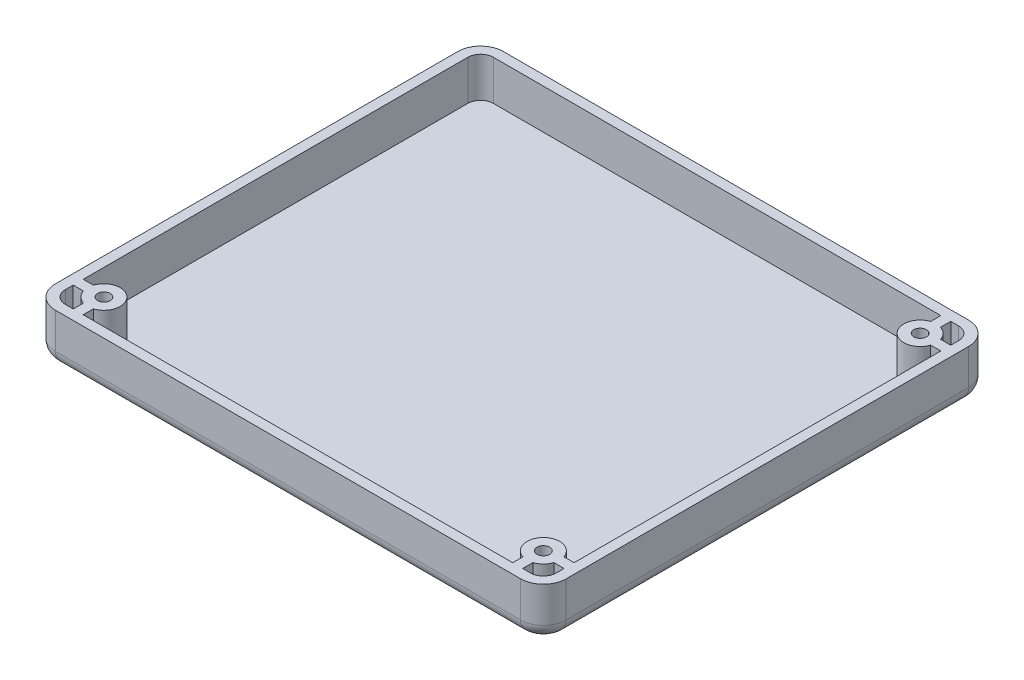
from build123d import *

# Parameters (mm, degrees)
SKETCH1_W               = 89.5
SKETCH1_H               = 78.5
BOSS_EXTRUDE1_DEPTH     = 21.75
FILLET2_R               = 4
SHELL1_T                = -1.75
CUT_EXTRUDE1_DEPTH      = 64.37339745
CUT_EXTRUDE1_DEPTH_BACK = 64.37339745
SKETCH3_W               = 22
SKETCH3_H               = 12
SKETCH3_4_R             = 3.75
CUT_EXTRUDE2_DEPTH      = 64.37339745
BOSS_EXTRUDE2_REACH     = 65.373
SKETCH3_5_R             = 1.1
BOSS_EXTRUDE3_REACH     = 65.373
SKETCH7_R               = 1.1
BOSS_EXTRUDE4_DEPTH     = 1
CUT_EXTRUDE3_DEPTH      = 64.72352395
CUT_EXTRUDE3_DEPTH_BACK = 64.72352395
SKETCH10_OUTSIDE_W      = 115.74
SKETCH10_OUTSIDE_H      = 48.99
SKETCH10_OUTSIDE_W_2    = 100
SKETCH10_OUTSIDE_H_2    = 7
SKETCH11_R              = 1.1
BOSS_EXTRUDE5_DEPTH     = 1.75
FILLET3_R               = 2.5


with BuildPart() as part:
    # Sketch1 → Boss-Extrude1 (new body)
    with BuildSketch(Plane(origin=(0, 0, 0), x_dir=(1, 0, 0), z_dir=(0, 1, 0))):
        Rectangle(SKETCH1_W, SKETCH1_H)
    extrude(amount=BOSS_EXTRUDE1_DEPTH)

    # Fillet2
    fillet2_edges = [part.edges().sort_by_distance(p)[0] for p in [
        (44.75, 10.875, -39.25),
        (44.75, 21.75, 0),
        (0, 21.75, 39.25),
        (44.75, 10.875, 39.25),
        (-44.75, 10.875, 39.25),
        (-44.75, 21.75, 0),
        (0, 21.75, -39.25),
        (-44.75, 10.875, -39.25),
    ]]
    fillet(fillet2_edges, radius=FILLET2_R)

    # Sketch4 → Cut-Loft1 section 0
    with BuildSketch(Plane(origin=(0, 21.75, 0), x_dir=(1, 0, 0), z_dir=(0, 1, 0))):
        with BuildLine():
            Line((5.5, -23), (34.5, -23))
            Line((34.5, -23), (34.5, -4))
            Line((34.5, -4), (5.5, -4))
            Line((5.5, -4), (5.5, -23))
        make_face()
    # Sketch5 → Cut-Loft1 section 1
    with BuildSketch(Plane(origin=(0, 17.75, 0), x_dir=(1, 0, 0), z_dir=(0, 1, 0))):
        with BuildLine():
            Line((31, -19.5), (31, -7.5))
            Line((31, -7.5), (9, -7.5))
            Line((9, -7.5), (9, -19.5))
            Line((9, -19.5), (31, -19.5))
        make_face()
    loft(mode=Mode.SUBTRACT)

    # Shell1
    shell1_openings = [part.faces().sort_by_distance(p)[0] for p in [
        (0, 0, 0),
    ]]
    offset(amount=SHELL1_T, openings=shell1_openings, kind=Kind.INTERSECTION)

    # Sketch3 → Cut-Extrude1 (cut, two sides: drawn at the far end of the back side and taken through both)
    with BuildSketch(Plane(origin=(0, 0, 0), x_dir=(1, 0, 0), z_dir=(0, 1, 0)).offset(-CUT_EXTRUDE1_DEPTH_BACK)):
        with Locations((20, -13.5)):
            Rectangle(SKETCH3_W, SKETCH3_H)
    extrude(amount=CUT_EXTRUDE1_DEPTH + CUT_EXTRUDE1_DEPTH_BACK, mode=Mode.SUBTRACT)

    # Sketch3<4> → Cut-Extrude2 (cut, through all)
    with BuildSketch(Plane(origin=(0, 0, 0), x_dir=(1, 0, 0), z_dir=(0, 1, 0))):
        with Locations((-18.5, -3.5)):
            Circle(SKETCH3_4_R)
        with Locations((-29.5, -14.5)):
            Circle(SKETCH3_4_R)
        with Locations((-18.5, -14.5)):
            Circle(SKETCH3_4_R)
        with Locations((-7.5, -14.5)):
            Circle(SKETCH3_4_R)
        with Locations((-18.5, -25.5)):
            Circle(SKETCH3_4_R)
    extrude(amount=CUT_EXTRUDE2_DEPTH, mode=Mode.SUBTRACT)

    # Sketch3<5> → Boss-Extrude2 (add, up to next)
    with BuildSketch(Plane(origin=(0, 0, 0), x_dir=(1, 0, 0), z_dir=(0, 1, 0)), mode=Mode.PRIVATE) as boss_extrude2_sk1:
        with BuildLine():
            Line((44.75, 32.125), (41.212355987, 32.125))
            ThreePointArc((41.212355987, 32.125), (36.484745674, 30.984745674), (37.625, 35.712355987))
            Line((37.625, 35.712355987), (37.625, 39.25))
            Line((37.625, 39.25), (39.375, 39.25))
            Line((39.375, 39.25), (39.375, 35.712355987))
            ThreePointArc((39.375, 35.712355987), (40.515254326, 35.015254326), (41.212355987, 33.875))
            Line((41.212355987, 33.875), (44.75, 33.875))
            Line((44.75, 33.875), (44.75, 32.125))
        make_face()
        with Locations((38.5, 33)):
            Circle(SKETCH3_5_R, mode=Mode.SUBTRACT)
    boss_extrude2_tool1 = extrude(boss_extrude2_sk1.sketch, amount=BOSS_EXTRUDE2_REACH, mode=Mode.PRIVATE) - part.part
    boss_extrude2 = boss_extrude2_tool1.solids().sort_by_distance((39.30816, 0, -33.80816))[0]
    add(boss_extrude2)

    # Mirror1: Boss-Extrude2 across plane
    add(boss_extrude2.mirror(Plane.XY))

    # Sketch7 → Boss-Extrude3 (add, up to next)
    with BuildSketch(Plane(origin=(0, 0, 0), x_dir=(1, 0, 0), z_dir=(0, 1, 0)), mode=Mode.PRIVATE) as boss_extrude3_sk1:
        with BuildLine():
            Line((-37.625, -35.712355987), (-37.625, -39.25))
            Line((-37.625, -39.25), (-39.375, -39.25))
            Line((-39.375, -39.25), (-39.375, -35.712355987))
            ThreePointArc((-39.375, -35.712355987), (-40.515254326, -35.015254326), (-41.212355987, -33.875))
            Line((-41.212355987, -33.875), (-44.75, -33.875))
            Line((-44.75, -33.875), (-44.75, -32.125))
            Line((-44.75, -32.125), (-41.212355987, -32.125))
            ThreePointArc((-41.212355987, -32.125), (-36.484745674, -30.984745674), (-37.625, -35.712355987))
        make_face()
        with Locations((-38.5, -33)):
            Circle(SKETCH7_R, mode=Mode.SUBTRACT)
    boss_extrude3_tool1 = extrude(boss_extrude3_sk1.sketch, amount=BOSS_EXTRUDE3_REACH, mode=Mode.PRIVATE) - part.part
    add(boss_extrude3_tool1.solids().sort_by_distance((-39.30816, 0, 33.80816))[0])

    # Sketch8 → Boss-Extrude4 (add)
    # profile 1 of 9: a face of its own
    with BuildSketch(Plane(origin=(0, 21.75, 0), x_dir=(1, 0, 0), z_dir=(0, 1, 0))):
        with BuildLine():
            Line((-32.428807867, 23.991700279), (-30.570364358, 23.991700279))
            add(Edge.make_bspline(
                [(-30.570364358, 23.991700279), (-30.479391142, 23.991221987), (-30.303062409, 23.990294938), (-30.046650928, 23.975917274), (-29.806488093, 23.956313001), (-29.582504256, 23.92520682), (-29.374802916, 23.887673484), (-29.182758131, 23.842220684), (-29.006980591, 23.787719686), (-28.797123787, 23.701052306), (-28.557853988, 23.572265684), (-28.298778363, 23.381960089), (-28.07724254, 23.1491896), (-27.886235491, 22.886618945), (-27.73437673, 22.597778023), (-27.62451457, 22.289551231), (-27.554960638, 21.965914204), (-27.547807542, 21.743728127), (-27.544192483, 21.631438861)],
                knots=[0, 0, 0, 0, 1.001505555, 1.941167018, 2.826882275, 3.653841531, 4.429895133, 5.150066043, 5.825578002, 6.45369114, 7.647487171, 8.808567382, 9.977351308, 11.170798116, 12.373658725, 13.556498008, 14.765093433, 16, 16, 16, 16], degree=3))
            add(Edge.make_bspline(
                [(-27.544192483, 21.631438861), (-27.547167599, 21.526248692), (-27.553013982, 21.319540089), (-27.608919634, 21.017205406), (-27.696442596, 20.729411018), (-27.818104738, 20.45720724), (-27.976225171, 20.206744336), (-28.163618167, 19.976001847), (-28.389705751, 19.774749328), (-28.559096282, 19.662237572), (-28.645138997, 19.605086698)],
                knots=[0, 0, 0, 0, 1.044552857, 2.05264487, 3.044412934, 4.028983338, 5.005914585, 5.980388656, 6.974128949, 8, 8, 8, 8], degree=3))
            add(Edge.make_bspline(
                [(-28.645138997, 19.605086698), (-28.536933833, 19.563544093), (-28.329910551, 19.484062801), (-28.045015046, 19.343540574), (-27.799556217, 19.190699402), (-27.591646842, 19.023789152), (-27.413835081, 18.843878746), (-27.258569575, 18.648330185), (-27.126086693, 18.434592565), (-27.012567951, 18.204894373), (-26.923988836, 17.961581055), (-26.857651554, 17.706934872), (-26.819640139, 17.441868939), (-26.814230915, 17.261478014), (-26.811500175, 17.170411217)],
                knots=[0, 0, 0, 0, 1.27268992, 2.434971085, 3.483601985, 4.442670788, 5.356604649, 6.2567628, 7.179492994, 8.113709626, 9.066344395, 10.018646069, 10.999752585, 12, 12, 12, 12], degree=3))
            add(Edge.make_bspline(
                [(-26.811500175, 17.170411217), (-26.814158592, 17.077428515), (-26.819389101, 16.894482444), (-26.857978881, 16.625727399), (-26.923317951, 16.368892723), (-27.013318714, 16.12231719), (-27.13078187, 15.886477824), (-27.273732973, 15.661107441), (-27.444180299, 15.448470442), (-27.634851393, 15.24620401), (-27.85055766, 15.06433696), (-28.083282679, 14.902369216), (-28.335957307, 14.769166004), (-28.604431662, 14.657271688), (-28.891717408, 14.571799241), (-29.196524504, 14.512002451), (-29.518590068, 14.4717116), (-29.739596605, 14.468399064), (-29.852936473, 14.466700279)],
                knots=[0, 0, 0, 0, 0.978564426, 1.925352924, 2.850884081, 3.763762016, 4.682927383, 5.618979971, 6.567305752, 7.547517671, 8.540179244, 9.531824382, 10.526200242, 11.540722885, 12.589160233, 13.674978461, 14.80764778, 16, 16, 16, 16], degree=3))
            Line((-29.852936473, 14.466700279), (-32.428807867, 14.466700279))
            Line((-32.428807867, 14.466700279), (-32.428807867, 23.991700279))
        make_face()
        with BuildLine():
            Line((-31.574000175, 23.014777203), (-31.574000175, 19.961892587))
            Line((-31.574000175, 19.961892587), (-30.999676257, 19.961892587))
            add(Edge.make_bspline(
                [(-30.999676257, 19.961892587), (-30.915723464, 19.962980949), (-30.753509559, 19.965083886), (-30.518596126, 19.971107815), (-30.300541612, 19.987975347), (-30.099722409, 20.004838032), (-29.916454758, 20.032255302), (-29.751144678, 20.064891008), (-29.601197782, 20.099406629), (-29.428279447, 20.158106447), (-29.232138066, 20.244859263), (-29.023042261, 20.379493331), (-28.838707741, 20.539851749), (-28.68304968, 20.724884295), (-28.555655606, 20.928627272), (-28.467171853, 21.147829854), (-28.407171744, 21.377028928), (-28.401751934, 21.534377173), (-28.399000175, 21.614266385)],
                knots=[0, 0, 0, 0, 1.156816544, 2.235205308, 3.236616184, 4.169592532, 5.011045266, 5.787822928, 6.49130361, 7.128639758, 8.301311294, 9.436451833, 10.541879658, 11.654887649, 12.756523258, 13.837046038, 14.901820046, 16, 16, 16, 16], degree=3))
            add(Edge.make_bspline(
                [(-28.399000175, 21.614266385), (-28.400432137, 21.667132235), (-28.403241086, 21.770834372), (-28.426246145, 21.922007971), (-28.465346473, 22.064185612), (-28.515568514, 22.199315727), (-28.585750588, 22.323172976), (-28.668382585, 22.440039816), (-28.76822007, 22.545936367), (-28.881859614, 22.644913359), (-29.012511652, 22.732664538), (-29.160098239, 22.809519758), (-29.326616132, 22.871407157), (-29.509258973, 22.925607544), (-29.710838147, 22.963675686), (-29.929027467, 22.995389548), (-30.165614095, 23.011535082), (-30.329294696, 23.013672391), (-30.413904021, 23.014777203)],
                knots=[0, 0, 0, 0, 0.91205012, 1.789085906, 2.630437955, 3.453916878, 4.269457761, 5.079663411, 5.91843418, 6.774407191, 7.675494373, 8.627863946, 9.638891023, 10.736472738, 11.911756761, 13.175263542, 14.539845004, 16, 16, 16, 16], degree=3))
            Line((-30.413904021, 23.014777203), (-31.574000175, 23.014777203))
        make_face(mode=Mode.SUBTRACT)
        with BuildLine():
            Line((-31.574000175, 18.98496951), (-31.574000175, 15.443623356))
            Line((-31.574000175, 15.443623356), (-30.356662435, 15.443623356))
            add(Edge.make_bspline(
                [(-30.356662435, 15.443623356), (-30.269525215, 15.444667698), (-30.101579711, 15.446680527), (-29.859097078, 15.453251565), (-29.634353059, 15.468198401), (-29.428373204, 15.491727463), (-29.23893333, 15.517250243), (-29.068306009, 15.551570943), (-28.915108104, 15.590892757), (-28.737468738, 15.651673612), (-28.537434191, 15.746097579), (-28.321867503, 15.888467009), (-28.130207581, 16.05807544), (-27.96745184, 16.254374571), (-27.834066492, 16.467819825), (-27.737032718, 16.694093955), (-27.677186172, 16.929458141), (-27.669941269, 17.089931837), (-27.666307867, 17.170411217)],
                knots=[0, 0, 0, 0, 1.160039823, 2.235823828, 3.228722157, 4.157150951, 4.99529583, 5.772374946, 6.472645482, 7.099169577, 8.269452708, 9.405989375, 10.527446681, 11.663510218, 12.788923519, 13.866172445, 14.929861265, 16, 16, 16, 16], degree=3))
            add(Edge.make_bspline(
                [(-27.666307867, 17.170411217), (-27.667059265, 17.220739522), (-27.668549942, 17.320584333), (-27.691030615, 17.467312383), (-27.723725504, 17.609441367), (-27.765993192, 17.747357218), (-27.827550456, 17.878566478), (-27.899413982, 18.005664158), (-27.983673225, 18.12881827), (-28.114966276, 18.284517331), (-28.30593432, 18.463905773), (-28.577279187, 18.639539976), (-28.885813798, 18.781184365), (-29.109590047, 18.841326511), (-29.225187074, 18.87239439)],
                knots=[0, 0, 0, 0, 0.723448775, 1.435228256, 2.130040452, 2.821711965, 3.505591119, 4.210454504, 4.921174351, 5.648778258, 7.137944449, 8.670945889, 10.280296675, 12, 12, 12, 12], degree=3))
            add(Edge.make_bspline(
                [(-29.225187074, 18.87239439), (-29.271530542, 18.881797154), (-29.37201274, 18.902184286), (-29.535863369, 18.923704536), (-29.722923127, 18.942877164), (-29.933623957, 18.957058957), (-30.168232439, 18.971718051), (-30.427249625, 18.977418957), (-30.709617745, 18.984220514), (-30.905539845, 18.984713458), (-31.007308468, 18.98496951)],
                knots=[0, 0, 0, 0, 0.634451884, 1.375622551, 2.216452059, 3.157844607, 4.20941857, 5.370758133, 6.634282058, 8, 8, 8, 8], degree=3))
            Line((-31.007308468, 18.98496951), (-31.574000175, 18.98496951))
        make_face(mode=Mode.SUBTRACT)
    # profile 2 of 9: a face of its own
    with BuildSketch(Plane(origin=(0, 21.75, 0), x_dir=(1, 0, 0), z_dir=(0, 1, 0))):
        with BuildLine():
            Line((-18.019192483, 21.427277203), (-18.019192483, 14.466700279))
            Line((-18.019192483, 14.466700279), (-18.874000175, 14.466700279))
            Line((-18.874000175, 14.466700279), (-18.874000175, 15.67068165))
            add(Edge.make_bspline(
                [(-18.874000175, 15.67068165), (-18.970389884, 15.561716755), (-19.158495612, 15.349070392), (-19.472660369, 15.071261051), (-19.805676625, 14.841631476), (-20.155928077, 14.656166348), (-20.52309844, 14.516850824), (-20.906373791, 14.417828491), (-21.305910478, 14.354163839), (-21.578740101, 14.347806522), (-21.716998973, 14.344584895)],
                knots=[0, 0, 0, 0, 1.074387032, 2.096679803, 3.090159297, 4.057316773, 5.018401886, 5.985159533, 6.978961417, 8, 8, 8, 8], degree=3))
            add(Edge.make_bspline(
                [(-21.716998973, 14.344584895), (-21.839920333, 14.347922379), (-22.082326698, 14.354504047), (-22.438912972, 14.405564316), (-22.782064022, 14.48756265), (-23.112104109, 14.601592928), (-23.426897591, 14.752852164), (-23.729139711, 14.933939418), (-24.01726468, 15.149587677), (-24.286880797, 15.396116525), (-24.535162169, 15.663891455), (-24.753043204, 15.949493265), (-24.934706943, 16.251686963), (-25.086617305, 16.566646475), (-25.203628786, 16.896796363), (-25.28519989, 17.240994941), (-25.336200677, 17.59883524), (-25.342779624, 17.842510656), (-25.34611556, 17.96606927)],
                knots=[0, 0, 0, 0, 1.033919861, 2.038935746, 3.024066025, 3.998881131, 4.97069526, 5.957263378, 6.95902576, 7.993208707, 9.027059324, 10.027763471, 11.009749337, 11.988697705, 12.965288445, 13.950418724, 14.960734635, 16, 16, 16, 16], degree=3))
            add(Edge.make_bspline(
                [(-25.34611556, 17.96606927), (-25.342705687, 18.087074063), (-25.335964554, 18.326294012), (-25.285745434, 18.678116754), (-25.201296761, 19.016984307), (-25.082784404, 19.341805702), (-24.930814512, 19.652973981), (-24.745953076, 19.950709221), (-24.528186743, 20.235831653), (-24.277128407, 20.50163692), (-24.005163068, 20.747165877), (-23.714218593, 20.960550494), (-23.411532378, 21.144837061), (-23.092409471, 21.290851164), (-22.761573278, 21.408985942), (-22.416078544, 21.490718519), (-22.057362747, 21.538880515), (-21.813820766, 21.545854894), (-21.690286233, 21.549392587)],
                knots=[0, 0, 0, 0, 1.020392517, 2.01726096, 2.990465484, 3.961182959, 4.928053699, 5.906110375, 6.912531644, 7.948652711, 8.985773172, 9.998621852, 10.987621588, 11.969261332, 12.953316658, 13.946091881, 14.958173133, 16, 16, 16, 16], degree=3))
            add(Edge.make_bspline(
                [(-21.690286233, 21.549392587), (-21.548228045, 21.545479849), (-21.269658643, 21.537807154), (-20.862184561, 21.473955018), (-20.476709231, 21.366081761), (-20.110257031, 21.219349141), (-19.764143878, 21.024362243), (-19.44164647, 20.778399634), (-19.139389691, 20.483012547), (-18.964183326, 20.256125837), (-18.874000175, 20.139341505)],
                knots=[0, 0, 0, 0, 1.038897134, 2.037228247, 3.008116434, 3.962042015, 4.918381754, 5.904844433, 6.921570401, 8, 8, 8, 8], degree=3))
            Line((-18.874000175, 20.139341505), (-18.874000175, 21.427277203))
            Line((-18.874000175, 21.427277203), (-18.019192483, 21.427277203))
        make_face()
        with BuildLine():
            add(Edge.make_bspline(
                [(-21.678837915, 20.694584895), (-21.803790506, 20.690139066), (-22.050427046, 20.681363708), (-22.412496795, 20.612855839), (-22.758971157, 20.498869908), (-23.088117259, 20.342981305), (-23.394735763, 20.146960243), (-23.668766396, 19.909865622), (-23.912450462, 19.638166319), (-24.117396524, 19.333088433), (-24.284466376, 19.006032342), (-24.40194237, 18.664154407), (-24.479419393, 18.313620861), (-24.487334724, 18.075869552), (-24.491307867, 17.956529005)],
                knots=[0, 0, 0, 0, 1.031046209, 2.035121221, 3.029706178, 4.034933723, 5.034054252, 6.02443088, 7.017295772, 8.038157696, 9.050218397, 10.03989886, 11.016116709, 12, 12, 12, 12], degree=3))
            add(Edge.make_bspline(
                [(-24.491307867, 17.956529005), (-24.486232693, 17.837901642), (-24.476102238, 17.601111895), (-24.403302134, 17.250100468), (-24.281164765, 16.908141968), (-24.114498865, 16.578138836), (-23.905801694, 16.271749249), (-23.663897575, 15.994870772), (-23.386447167, 15.756774107), (-23.079123022, 15.557463282), (-22.750897046, 15.396456707), (-22.405727561, 15.284427359), (-22.050103145, 15.212097828), (-21.808297865, 15.203649216), (-21.686470127, 15.199392587)],
                knots=[0, 0, 0, 0, 0.979072187, 1.954306742, 2.945804271, 3.96968567, 4.997920485, 5.998718438, 6.996577872, 8.005894225, 9.015743152, 10.005417472, 10.995077863, 12, 12, 12, 12], degree=3))
            add(Edge.make_bspline(
                [(-21.686470127, 15.199392587), (-21.562790716, 15.20391006), (-21.316804634, 15.212894867), (-20.953660722, 15.281696024), (-20.60124943, 15.395366826), (-20.26437133, 15.552935163), (-19.950546716, 15.748217682), (-19.668884635, 15.97683698), (-19.430716178, 16.242729216), (-19.22880629, 16.534946564), (-19.070486049, 16.855291354), (-18.955162631, 17.196379402), (-18.886980216, 17.558222581), (-18.87838668, 17.805502267), (-18.874000175, 17.931724318)],
                knots=[0, 0, 0, 0, 1.01762866, 2.023962475, 3.030623092, 4.058876274, 5.077231937, 6.066672613, 7.034107872, 8.005628644, 8.981990164, 9.965428785, 10.961468474, 12, 12, 12, 12], degree=3))
            add(Edge.make_bspline(
                [(-18.874000175, 17.931724318), (-18.876611811, 18.0278937), (-18.881752338, 18.217185476), (-18.921024102, 18.49511822), (-18.983494295, 18.761093575), (-19.071522086, 19.015391178), (-19.187159081, 19.256605042), (-19.326626216, 19.486467132), (-19.492376047, 19.703781943), (-19.681740384, 19.905557015), (-19.889018542, 20.089597601), (-20.108350828, 20.253874571), (-20.342335846, 20.388826874), (-20.58703864, 20.500517763), (-20.842883771, 20.589397306), (-21.111953101, 20.648690959), (-21.39138663, 20.689404404), (-21.582011966, 20.692839883), (-21.678837915, 20.694584895)],
                knots=[0, 0, 0, 0, 1.050140795, 2.067009409, 3.05949893, 4.030605086, 5.00011959, 5.97591094, 6.962425594, 7.979863591, 8.993523472, 9.986985069, 10.967611495, 11.937549037, 12.921786183, 13.919465291, 14.943216303, 16, 16, 16, 16], degree=3))
        make_face(mode=Mode.SUBTRACT)
    # profile 3 of 9: a face of its own
    with BuildSketch(Plane(origin=(0, 21.75, 0), x_dir=(1, 0, 0), z_dir=(0, 1, 0))):
        with BuildLine():
            Line((-16.065346329, 14.466700279), (-16.065346329, 24.235931049))
            Line((-16.065346329, 24.235931049), (-15.210538636, 24.235931049))
            Line((-15.210538636, 24.235931049), (-15.210538636, 20.164146193))
            add(Edge.make_bspline(
                [(-15.210538636, 20.164146193), (-15.114217975, 20.275065993), (-14.926292393, 20.491475096), (-14.611215051, 20.774089058), (-14.280818465, 21.013717585), (-13.932589212, 21.211255522), (-13.566032015, 21.361678695), (-13.183039634, 21.471685342), (-12.782633016, 21.538052557), (-12.50962155, 21.545580227), (-12.371355944, 21.549392587)],
                knots=[0, 0, 0, 0, 1.077089805, 2.101446609, 3.097517232, 4.067117542, 5.031729543, 5.997785507, 6.985986182, 8, 8, 8, 8], degree=3))
            add(Edge.make_bspline(
                [(-12.371355944, 21.549392587), (-12.248439526, 21.546017395), (-12.00541282, 21.539344064), (-11.648137834, 21.488631616), (-11.304385278, 21.406396026), (-10.974342265, 21.292389453), (-10.659548818, 21.14112435), (-10.357309528, 20.960036934), (-10.069172877, 20.744395481), (-9.799602081, 20.49783865), (-9.551152291, 20.230168126), (-9.333676103, 19.943927411), (-9.149980501, 19.643277344), (-8.998039626, 19.329224317), (-8.880552689, 19.000485676), (-8.799611233, 18.657383749), (-8.74819402, 18.30025607), (-8.74171635, 18.057197655), (-8.738423252, 17.933632371)],
                knots=[0, 0, 0, 0, 1.034377878, 2.045141349, 3.03070803, 4.00595497, 4.978199603, 5.965204761, 6.967410914, 8.002051993, 9.036360596, 10.037508045, 11.022711142, 11.997267194, 12.969246472, 13.954813154, 14.960274251, 16, 16, 16, 16], degree=3))
            add(Edge.make_bspline(
                [(-8.738423252, 17.933632371), (-8.741788136, 17.811984466), (-8.748423159, 17.572113954), (-8.799099719, 17.219126826), (-8.882773482, 16.879387223), (-9.002410702, 16.553773037), (-9.152810285, 16.240754559), (-9.340891686, 15.943900031), (-9.55809162, 15.658043961), (-9.809364245, 15.392368221), (-10.081271843, 15.146804468), (-10.372231318, 14.933428507), (-10.674913834, 14.749141201), (-10.994037018, 14.603121733), (-11.324875759, 14.485009226), (-11.67097449, 14.403046082), (-12.030375132, 14.355222268), (-12.274538679, 14.348158617), (-12.398068685, 14.344584895)],
                knots=[0, 0, 0, 0, 1.024244038, 2.01964794, 2.996620209, 3.965911562, 4.936179293, 5.91563013, 6.920572822, 7.955171681, 8.990768464, 10.002129126, 10.989675881, 11.969873457, 12.952483066, 13.943799762, 14.959703725, 16, 16, 16, 16], degree=3))
            add(Edge.make_bspline(
                [(-12.398068685, 14.344584895), (-12.539488026, 14.348505407), (-12.816786696, 14.356192849), (-13.222422878, 14.419925928), (-13.606366237, 14.528406453), (-13.972990423, 14.674170945), (-14.31705444, 14.871552496), (-14.640742739, 15.116363367), (-14.942014061, 15.412637502), (-15.119496965, 15.638683414), (-15.210538636, 15.754635977)],
                knots=[0, 0, 0, 0, 1.035807596, 2.031038093, 2.998900396, 3.954262848, 4.914341711, 5.895762244, 6.92060972, 8, 8, 8, 8], degree=3))
            Line((-15.210538636, 15.754635977), (-15.210538636, 14.466700279))
            Line((-15.210538636, 14.466700279), (-16.065346329, 14.466700279))
        make_face()
        with BuildLine():
            add(Edge.make_bspline(
                [(-12.405700896, 15.199392587), (-12.280748265, 15.203838392), (-12.034111647, 15.212613702), (-11.672042474, 15.281121919), (-11.325565947, 15.395106543), (-10.996427988, 15.551000064), (-10.689779288, 15.747002887), (-10.415860334, 15.984164966), (-10.172347696, 16.25495123), (-9.96918822, 16.56038721), (-9.799571798, 16.88546449), (-9.683058524, 17.227423696), (-9.604899855, 17.577113087), (-9.597137528, 17.814274822), (-9.593230944, 17.933632371)],
                knots=[0, 0, 0, 0, 1.031910345, 2.036826888, 3.032245421, 4.038315463, 5.03827337, 6.029480047, 7.023177075, 8.037597977, 9.052889626, 10.043399556, 11.015292101, 12, 12, 12, 12], degree=3))
            add(Edge.make_bspline(
                [(-9.593230944, 17.933632371), (-9.598368304, 18.052873238), (-9.608622515, 18.290878933), (-9.680399602, 18.643711242), (-9.805742587, 18.985488992), (-9.972070922, 19.315266232), (-10.178540225, 19.622808889), (-10.420763597, 19.899007021), (-10.698027655, 20.137295264), (-11.005068532, 20.335932529), (-11.332130337, 20.498019598), (-11.676365561, 20.609176417), (-12.030581595, 20.681942484), (-12.271143615, 20.690349326), (-12.392344526, 20.694584895)],
                knots=[0, 0, 0, 0, 0.984795267, 1.965658976, 2.959410029, 3.983795688, 5.009594896, 6.01088574, 7.009236619, 8.019050059, 9.024672985, 10.014834719, 10.999826153, 12, 12, 12, 12], degree=3))
            add(Edge.make_bspline(
                [(-12.392344526, 20.694584895), (-12.5160811, 20.69035172), (-12.761673091, 20.681949726), (-13.124080896, 20.609048576), (-13.478038833, 20.497340433), (-13.816278473, 20.336962976), (-14.13156701, 20.140716787), (-14.413541333, 19.910102387), (-14.656650786, 19.64672278), (-14.856794905, 19.351431991), (-15.015739394, 19.032521287), (-15.129450879, 18.692309505), (-15.197485632, 18.332587505), (-15.206134693, 18.085935709), (-15.210538636, 17.960345111)],
                knots=[0, 0, 0, 0, 1.016820015, 2.018181405, 3.029022337, 4.06341356, 5.088169224, 6.076823655, 7.05054209, 8.02560866, 9.001194327, 9.972267242, 10.967515442, 12, 12, 12, 12], degree=3))
            add(Edge.make_bspline(
                [(-15.210538636, 17.960345111), (-15.207926962, 17.864175763), (-15.20278636, 17.674884051), (-15.163515142, 17.396950836), (-15.101042949, 17.130977206), (-15.01302244, 16.876673325), (-14.897358366, 16.6354828), (-14.757993285, 16.405532754), (-14.592117733, 16.188898118), (-14.404593372, 15.986109996), (-14.197867179, 15.801571518), (-13.976007835, 15.641610777), (-13.743549037, 15.503867874), (-13.49783133, 15.394072267), (-13.241714176, 15.304465093), (-12.972569404, 15.245318256), (-12.693156457, 15.204564758), (-12.502528285, 15.201134797), (-12.405700896, 15.199392587)],
                knots=[0, 0, 0, 0, 1.050331198, 2.067384183, 3.060053655, 4.031335885, 5.001026174, 5.976994447, 6.963687968, 7.976578778, 8.990422448, 9.985569286, 10.960374351, 11.936812464, 12.921228065, 13.919088064, 14.943024695, 16, 16, 16, 16], degree=3))
        make_face(mode=Mode.SUBTRACT)
    # profile 4 of 9: a face of its own
    with BuildSketch(Plane(origin=(0, 21.75, 0), x_dir=(1, 0, 0), z_dir=(0, 1, 0))):
        Polygon((-7.761500175, 21.427277203), (-6.839910632, 21.427277203), (-4.483465319, 16.096177443), (-2.090767002, 21.427277203), (-1.167269406, 21.427277203), (-5.441307867, 11.902277203), (-6.364805463, 11.902277203), (-4.94712217, 15.060104727), align=None)
    # profile 5 of 9: a face of its own
    with BuildSketch(Plane(origin=(0, 21.75, 0), x_dir=(1, 0, 0), z_dir=(0, 1, 0))):
        with BuildLine():
            Line((0.175999825, 23.991700279), (2.082144657, 23.991700279))
            add(Edge.make_bspline(
                [(2.082144657, 23.991700279), (2.209347299, 23.991276863), (2.453590464, 23.990463857), (2.803493435, 23.985930603), (3.121430035, 23.972937535), (3.407234026, 23.961756318), (3.660900166, 23.941367535), (3.883206293, 23.921880345), (4.073128527, 23.896370597), (4.188097594, 23.87267941), (4.240152469, 23.861952683)],
                knots=[0, 0, 0, 0, 1.410062039, 2.707475311, 3.878576406, 4.937260626, 5.877586885, 6.699081471, 7.410979367, 8, 8, 8, 8], degree=3))
            add(Edge.make_bspline(
                [(4.240152469, 23.861952683), (4.309839068, 23.844734843), (4.447725661, 23.810666466), (4.646254055, 23.738658553), (4.835432322, 23.655329432), (5.01447463, 23.557456736), (5.182484176, 23.444313942), (5.341193293, 23.317854266), (5.491322161, 23.178769656), (5.626799312, 23.023553409), (5.754540588, 22.860712622), (5.862278207, 22.684625969), (5.955150984, 22.500489955), (6.029093606, 22.306431911), (6.088632948, 22.104333803), (6.130614356, 21.892365007), (6.155790803, 21.67149121), (6.158353995, 21.520838616), (6.159653671, 21.444449679)],
                knots=[0, 0, 0, 0, 1.027469482, 2.033020251, 3.019912614, 3.986113645, 4.951240523, 5.91722682, 6.890402269, 7.87763091, 8.8651537, 9.85103654, 10.82876324, 11.815024772, 12.821070561, 13.842952187, 14.906261191, 16, 16, 16, 16], degree=3))
            add(Edge.make_bspline(
                [(6.159653671, 21.444449679), (6.155655898, 21.317535572), (6.147855206, 21.06989328), (6.075124746, 20.710499024), (5.955990074, 20.375248103), (5.791824552, 20.064562639), (5.582765836, 19.784498668), (5.331510511, 19.538507501), (5.037918412, 19.332658881), (4.764607202, 19.18991232), (4.523177844, 19.098491619), (4.3244229, 19.034166956), (4.107614911, 18.984468322), (3.874831165, 18.939945392), (3.625102931, 18.906331138), (3.359028752, 18.881711477), (3.076418868, 18.866324388), (2.882274687, 18.864032932), (2.782400065, 18.862854126)],
                knots=[0, 0, 0, 0, 1.260483769, 2.459530307, 3.627416485, 4.787058657, 5.939039949, 7.08810263, 8.267026773, 9.491475466, 10.141966685, 10.831826277, 11.566392101, 12.351337768, 13.187381173, 14.07005841, 15.007169909, 16, 16, 16, 16], degree=3))
            Line((2.782400065, 18.862854126), (6.281769056, 14.466700279))
            Line((6.281769056, 14.466700279), (5.224707758, 14.466700279))
            Line((5.224707758, 14.466700279), (1.725338767, 18.862854126))
            Line((1.725338767, 18.862854126), (1.030807517, 18.862854126))
            Line((1.030807517, 18.862854126), (1.030807517, 14.466700279))
            Line((1.030807517, 14.466700279), (0.175999825, 14.466700279))
            Line((0.175999825, 14.466700279), (0.175999825, 23.991700279))
        make_face()
        with BuildLine():
            Line((1.030807517, 23.014777203), (1.030807517, 19.839777203))
            Line((1.030807517, 19.839777203), (2.774767854, 19.826420832))
            add(Edge.make_bspline(
                [(2.774767854, 19.826420832), (2.856193103, 19.82638481), (3.014018426, 19.826314988), (3.242348092, 19.837183764), (3.454946396, 19.849548081), (3.651000158, 19.868460228), (3.830596959, 19.892833538), (3.993647034, 19.923321659), (4.140416539, 19.958841915), (4.311590419, 20.013819197), (4.502734122, 20.100921289), (4.710464738, 20.227645968), (4.887363957, 20.387037642), (5.036818996, 20.569301119), (5.156914092, 20.76969691), (5.241583326, 20.985822887), (5.295310972, 21.212222878), (5.301647942, 21.367829015), (5.304845979, 21.446357731)],
                knots=[0, 0, 0, 0, 1.146690395, 2.22261258, 3.21895312, 4.145990853, 4.996080663, 5.770904154, 6.481378293, 7.121626537, 8.300444488, 9.431385265, 10.535395872, 11.636531494, 12.74115979, 13.810798291, 14.895190096, 16, 16, 16, 16], degree=3))
            add(Edge.make_bspline(
                [(5.304845979, 21.446357731), (5.301574492, 21.522956621), (5.295091599, 21.674747671), (5.242163165, 21.896968398), (5.152657063, 22.106700598), (5.032037258, 22.303091089), (4.885082415, 22.481360271), (4.712767511, 22.633888594), (4.519804087, 22.759753209), (4.339451754, 22.840183344), (4.178250076, 22.889495231), (4.038287929, 22.924196612), (3.880141694, 22.952076203), (3.703043481, 22.974413854), (3.507749329, 22.993613381), (3.293271771, 23.006545007), (3.061033819, 23.014202737), (2.900069671, 23.014581258), (2.816745017, 23.014777203)],
                knots=[0, 0, 0, 0, 1.101028733, 2.181837193, 3.264309656, 4.369019818, 5.486613113, 6.575447106, 7.666700264, 8.788928104, 9.402425223, 10.0903467, 10.862060571, 11.710948788, 12.657782767, 13.684531032, 14.801375019, 16, 16, 16, 16], degree=3))
            Line((2.816745017, 23.014777203), (1.030807517, 23.014777203))
        make_face(mode=Mode.SUBTRACT)
    # profile 6 of 9: a face of its own
    with BuildSketch(Plane(origin=(0, 21.75, 0), x_dir=(1, 0, 0), z_dir=(0, 1, 0))):
        Polygon((7.136576748, 23.014777203), (7.136576748, 23.991700279), (12.143307517, 23.991700279), (12.143307517, 23.014777203), (10.067345979, 23.014777203), (10.067345979, 14.466700279), (9.212538287, 14.466700279), (9.212538287, 23.014777203), align=None)
    # profile 7 of 9: a face of its own
    with BuildSketch(Plane(origin=(0, 21.75, 0), x_dir=(1, 0, 0), z_dir=(0, 1, 0))):
        with BuildLine():
            add(Edge.make_bspline(
                [(18.065903671, 24.235931049), (18.242274302, 24.23146388), (18.588680773, 24.222689992), (19.097791745, 24.155527574), (19.58382554, 24.03933512), (20.050741417, 23.884586575), (20.492954447, 23.678154283), (20.913793147, 23.428639701), (21.312256211, 23.133428767), (21.68297297, 22.794803514), (22.022217956, 22.426367114), (22.321101261, 22.033180802), (22.571587789, 21.617621918), (22.77728911, 21.180939229), (22.938666041, 20.724120316), (23.050024295, 20.24472978), (23.121157404, 19.745873717), (23.129473484, 19.405622035), (23.133692133, 19.233016385)],
                knots=[0, 0, 0, 0, 1.065120563, 2.091984664, 3.0946048, 4.079830382, 5.057816894, 6.036188127, 7.030412546, 8.04752943, 9.064399622, 10.05169764, 11.02544977, 11.989514704, 12.962713494, 13.945757189, 14.957906945, 16, 16, 16, 16], degree=3))
            add(Edge.make_bspline(
                [(23.133692133, 19.233016385), (23.129474102, 19.061682192), (23.121159875, 18.723962648), (23.049943416, 18.228272275), (22.938253266, 17.751775451), (22.778787713, 17.295267639), (22.574066947, 16.858267269), (22.321912517, 16.441924201), (22.024892508, 16.046101945), (21.686872434, 15.675136763), (21.31838817, 15.334965075), (20.923154373, 15.038550135), (20.510059695, 14.783486624), (20.073788275, 14.579968197), (19.620126032, 14.417303185), (19.14501271, 14.306397813), (18.650674587, 14.234859503), (18.313568499, 14.226644827), (18.142225787, 14.22246951)],
                knots=[0, 0, 0, 0, 1.043624062, 2.057103931, 3.04512605, 4.022047818, 4.998200453, 5.980619268, 6.982898556, 8.009068085, 9.034988726, 10.034168286, 11.015286542, 11.987931943, 12.962482838, 13.94673481, 14.956375938, 16, 16, 16, 16], degree=3))
            add(Edge.make_bspline(
                [(18.142225787, 14.22246951), (17.969621033, 14.226686056), (17.629371117, 14.23499799), (17.129888185, 14.306248813), (16.650160896, 14.417667647), (16.191561126, 14.576896898), (15.753833139, 14.78268379), (15.336120842, 15.033611422), (14.940100877, 15.331355142), (14.569056553, 15.669265606), (14.229560521, 16.037125329), (13.933579648, 16.431281409), (13.68259559, 16.844000902), (13.477499664, 17.276429164), (13.315127099, 17.726475733), (13.204351844, 18.197142661), (13.132680432, 18.685746602), (13.124421314, 19.018421918), (13.120230594, 19.187223116)],
                knots=[0, 0, 0, 0, 1.053102029, 2.075944431, 3.073151272, 4.055350789, 5.033113405, 6.020478099, 7.024410459, 8.052272461, 9.079885166, 10.07527673, 11.055994387, 12.023226415, 12.992069828, 13.970394897, 14.97016774, 16, 16, 16, 16], degree=3))
            add(Edge.make_bspline(
                [(13.120230594, 19.187223116), (13.121685567, 19.300523451), (13.124577156, 19.525694787), (13.159388834, 19.860067464), (13.209903178, 20.189062754), (13.282298382, 20.511745119), (13.376981419, 20.827324656), (13.488701579, 21.137977804), (13.625153587, 21.440556366), (13.779405922, 21.736493739), (13.951568414, 22.021176683), (14.141730275, 22.290270406), (14.343212242, 22.546032975), (14.56409262, 22.781836607), (14.79709166, 23.004541058), (15.045989104, 23.210723881), (15.309266212, 23.402244283), (15.588055831, 23.574838211), (15.875488422, 23.730936999), (16.171788796, 23.864890751), (16.472932751, 23.979860389), (16.780330757, 24.073044349), (17.093166515, 24.146610104), (17.4121228, 24.196704403), (17.736945511, 24.231604868), (17.955779171, 24.234482784), (18.065903671, 24.235931049)],
                knots=[0, 0, 0, 0, 1.037015668, 2.060948919, 3.074880161, 4.083647147, 5.086022904, 6.090072063, 7.104153813, 8.122640571, 9.144368836, 10.147691507, 11.138137339, 12.123020368, 13.103399296, 14.087645067, 15.080126199, 16.082011238, 17.087798457, 18.072939717, 19.057185487, 20.037253025, 21.01195951, 21.997135196, 22.992090687, 24, 24, 24, 24], degree=3))
        make_face()
        with BuildLine():
            add(Edge.make_bspline(
                [(18.107880835, 23.259007972), (18.017489582, 23.257906092), (17.837571223, 23.255712866), (17.570096878, 23.226822954), (17.306140258, 23.185648042), (17.045646851, 23.126915475), (16.789706592, 23.046894446), (16.53593381, 22.954798831), (16.286642642, 22.842618578), (16.042656072, 22.715874289), (15.806122903, 22.575587583), (15.582931194, 22.420542989), (15.372503141, 22.254376495), (15.175353966, 22.076700309), (14.992062561, 21.886609607), (14.819021338, 21.686986191), (14.663166262, 21.472124259), (14.520330514, 21.247850223), (14.392510892, 21.014456206), (14.278849462, 20.774399367), (14.185874552, 20.525721519), (14.110049085, 20.271120562), (14.0471846, 20.010999725), (14.007359421, 19.743385736), (13.978152071, 19.469623324), (13.976084206, 19.284615564), (13.975038287, 19.191039222)],
                knots=[0, 0, 0, 0, 1.008559885, 2.007477868, 2.99961109, 3.989939068, 4.984837346, 5.991145699, 7.001802488, 8.033829008, 9.059044045, 10.069351652, 11.065060232, 12.050310815, 13.029377138, 14.011219647, 14.996725999, 15.989392538, 16.977580475, 17.965360261, 18.951710183, 19.937753436, 20.929683414, 21.935841486, 22.955955122, 24, 24, 24, 24], degree=3))
            add(Edge.make_bspline(
                [(13.975038287, 19.191039222), (13.978507732, 19.053437749), (13.985333205, 18.782733085), (14.045089164, 18.386035493), (14.137133252, 18.004795228), (14.272816513, 17.641098318), (14.442499257, 17.29181852), (14.652122437, 16.960054321), (14.90047752, 16.645716055), (15.182590403, 16.350998216), (15.490990055, 16.08199642), (15.818466984, 15.845876001), (16.161512873, 15.64609525), (16.521022303, 15.483340017), (16.895075963, 15.354372231), (17.286084156, 15.265983956), (17.691442192, 15.207812181), (17.967750618, 15.202225752), (18.107880835, 15.199392587)],
                knots=[0, 0, 0, 0, 1.032063989, 2.030389145, 3.003944642, 3.970395727, 4.937377036, 5.913328081, 6.909231446, 7.93887556, 8.970685674, 9.976071282, 10.964166581, 11.944589148, 12.933237628, 13.927779006, 14.949070134, 16, 16, 16, 16], degree=3))
            add(Edge.make_bspline(
                [(18.107880835, 15.199392587), (18.202068121, 15.200686638), (18.388869799, 15.20325313), (18.66671547, 15.229103101), (18.939555589, 15.270555546), (19.207007465, 15.330238258), (19.468767559, 15.40493387), (19.725928416, 15.493673473), (19.975750906, 15.604384463), (20.221386608, 15.726707102), (20.456507808, 15.866153531), (20.680959078, 16.015935924), (20.889082995, 16.18185767), (21.086084682, 16.356894003), (21.270128607, 16.544574189), (21.4399702, 16.744654221), (21.59503756, 16.95839701), (21.737819069, 17.182330864), (21.865190806, 17.416363523), (21.976168211, 17.657290718), (22.070319069, 17.904519195), (22.1463245, 18.158405543), (22.205884221, 18.418467567), (22.246923146, 18.685053479), (22.275629968, 18.957629976), (22.277793714, 19.141990041), (22.27888444, 19.234924438)],
                knots=[0, 0, 0, 0, 1.047197238, 2.076906641, 3.100256066, 4.114471768, 5.12198147, 6.126382909, 7.136867548, 8.15857795, 9.17633901, 10.174870724, 11.156907918, 12.133735059, 13.104061851, 14.077631395, 15.04955518, 16.038496417, 17.029181396, 18.010275684, 18.986308667, 19.968651475, 20.955262928, 21.950658345, 22.966943676, 24, 24, 24, 24], degree=3))
            add(Edge.make_bspline(
                [(22.27888444, 19.234924438), (22.27779284, 19.32722306), (22.27562745, 19.51031438), (22.246936858, 19.780989893), (22.205840864, 20.045657561), (22.146615208, 20.303278339), (22.070278718, 20.553917897), (21.976151769, 20.797340832), (21.86515749, 21.034453991), (21.737772251, 21.264671328), (21.594582045, 21.485582579), (21.438115569, 21.696772002), (21.2656713, 21.894273533), (21.08217619, 22.082962951), (20.883046852, 22.258815922), (20.669185308, 22.421890782), (20.443187871, 22.576123049), (20.20390018, 22.715257614), (19.956946992, 22.843747776), (19.703544006, 22.953832292), (19.446561957, 23.04737356), (19.186654337, 23.127157586), (18.921633517, 23.185418011), (18.65329024, 23.226860061), (18.381995765, 23.255702811), (18.199542431, 23.257902755), (18.107880835, 23.259007972)],
                knots=[0, 0, 0, 0, 1.02996197, 2.043119294, 3.035359645, 4.018872909, 4.991431989, 5.957985074, 6.929999688, 7.912076566, 8.892894881, 9.867085534, 10.843653904, 11.817741046, 12.803660682, 13.806313499, 14.818574707, 15.856120519, 16.894564902, 17.924820532, 18.937903209, 19.946497019, 20.957711757, 21.963978472, 22.977135795, 24, 24, 24, 24], degree=3))
        make_face(mode=Mode.SUBTRACT)
    # profile 8 of 9: a face of its own
    with BuildSketch(Plane(origin=(0, 21.75, 0), x_dir=(1, 0, 0), z_dir=(0, 1, 0))):
        with BuildLine():
            Line((24.11061521, 16.304155207), (24.915813527, 16.786892587))
            add(Edge.make_bspline(
                [(24.915813527, 16.786892587), (24.990702444, 16.661531654), (25.134186719, 16.421344943), (25.373540061, 16.096792705), (25.621551769, 15.820942835), (25.880058455, 15.595400068), (26.147482214, 15.417829883), (26.425568818, 15.29209381), (26.713381145, 15.213673191), (26.90925276, 15.204147955), (27.007039489, 15.199392587)],
                knots=[0, 0, 0, 0, 1.272034388, 2.437168799, 3.508375237, 4.49857839, 5.41946034, 6.295179144, 7.148887113, 8, 8, 8, 8], degree=3))
            add(Edge.make_bspline(
                [(27.007039489, 15.199392587), (27.090551587, 15.201718517), (27.25611452, 15.206329679), (27.499851767, 15.250636719), (27.736566529, 15.318705442), (27.961380036, 15.416189548), (28.171190244, 15.534132141), (28.355177036, 15.676588524), (28.514233958, 15.836081127), (28.644343049, 16.014015351), (28.744165145, 16.205378449), (28.820887845, 16.401800145), (28.863464796, 16.606366034), (28.869878532, 16.744098794), (28.87311521, 16.813605328)],
                knots=[0, 0, 0, 0, 1.095163259, 2.171163733, 3.241058638, 4.321873601, 5.38011039, 6.391990106, 7.366004449, 8.327778327, 9.272591725, 10.192022065, 11.087607919, 12, 12, 12, 12], degree=3))
            add(Edge.make_bspline(
                [(28.87311521, 16.813605328), (28.869102978, 16.892910069), (28.860946699, 17.054125018), (28.792008885, 17.291976931), (28.683562006, 17.527360282), (28.583515097, 17.672960155), (28.531573743, 17.748551241)],
                knots=[0, 0, 0, 0, 0.938893495, 1.908633276, 2.914225137, 4, 4, 4, 4], degree=3))
            add(Edge.make_bspline(
                [(28.531573743, 17.748551241), (28.488927286, 17.80310724), (28.399396384, 17.917640734), (28.245479153, 18.088125268), (28.064868513, 18.263979679), (27.863745268, 18.45191897), (27.634783076, 18.643202188), (27.385153197, 18.846950859), (27.108482267, 19.055416579), (26.91444578, 19.195223347), (26.814326147, 19.267361337)],
                knots=[0, 0, 0, 0, 0.722233717, 1.516239348, 2.393582979, 3.351407094, 4.387010283, 5.505090956, 6.712668013, 8, 8, 8, 8], degree=3))
            add(Edge.make_bspline(
                [(26.814326147, 19.267361337), (26.714112272, 19.338740565), (26.522510973, 19.475212213), (26.254562974, 19.677752586), (26.014956257, 19.862929116), (25.804755791, 20.032485035), (25.624054031, 20.186443338), (25.471427034, 20.323325587), (25.350762818, 20.446833706), (25.283664416, 20.526956214), (25.253538888, 20.562929246)],
                knots=[0, 0, 0, 0, 1.452282411, 2.77665338, 3.964542531, 5.026858415, 5.96415736, 6.766646006, 7.446254459, 8, 8, 8, 8], degree=3))
            add(Edge.make_bspline(
                [(25.253538888, 20.562929246), (25.211431461, 20.618993496), (25.128621555, 20.729251369), (25.01931264, 20.901585446), (24.926405347, 21.077997332), (24.853573572, 21.258961078), (24.792242862, 21.441936134), (24.750991636, 21.629309882), (24.725161478, 21.820241551), (24.722516286, 21.94872972), (24.721192133, 22.013049438)],
                knots=[0, 0, 0, 0, 1.068054152, 2.10047183, 3.106115577, 4.101338837, 5.06977816, 6.043150881, 7.020423561, 8, 8, 8, 8], degree=3))
            add(Edge.make_bspline(
                [(24.721192133, 22.013049438), (24.724744166, 22.113823325), (24.73177231, 22.313217127), (24.791209717, 22.604493887), (24.885025235, 22.882586922), (25.016456323, 23.144743045), (25.185885262, 23.384136178), (25.381953235, 23.603520025), (25.615483065, 23.787947381), (25.871712704, 23.949088768), (26.15217326, 24.075215893), (26.44606279, 24.170359704), (26.753848393, 24.224269184), (26.962318352, 24.232005565), (27.068097181, 24.235931049)],
                knots=[0, 0, 0, 0, 1.005424448, 1.989358655, 2.955360095, 3.929531133, 4.905563448, 5.876582895, 6.856512386, 7.866279853, 8.892233794, 9.918561126, 10.94386622, 12, 12, 12, 12], degree=3))
            add(Edge.make_bspline(
                [(27.068097181, 24.235931049), (27.180340054, 24.232059676), (27.403555304, 24.224360752), (27.731893526, 24.157420327), (28.048016619, 24.046656356), (28.302315789, 23.920957223), (28.501341376, 23.79541387), (28.653122884, 23.68105992), (28.80693109, 23.549410517), (28.964006653, 23.400114997), (29.121688019, 23.231803482), (29.282316128, 23.045628678), (29.446266603, 22.842728337), (29.551737908, 22.69788166), (29.605807517, 22.623626361)],
                knots=[0, 0, 0, 0, 1.286793592, 2.559021753, 3.825965368, 5.121522368, 5.803751409, 6.523245864, 7.299691795, 8.125521123, 9.008227632, 9.944561021, 10.946284179, 12, 12, 12, 12], degree=3))
            Line((29.605807517, 22.623626361), (28.833046099, 22.037854126))
            add(Edge.make_bspline(
                [(28.833046099, 22.037854126), (28.786384669, 22.097966919), (28.696525663, 22.213730104), (28.560101845, 22.375849184), (28.431518025, 22.523939746), (28.304834437, 22.652568416), (28.186741769, 22.768779222), (28.072123246, 22.868273989), (27.962628333, 22.952027573), (27.824605884, 23.041408976), (27.651202665, 23.130009175), (27.433530462, 23.204982023), (27.206056385, 23.250035441), (27.05112646, 23.255992343), (26.972694537, 23.259007972)],
                knots=[0, 0, 0, 0, 1.181633172, 2.275549214, 3.290209073, 4.226197932, 5.078386478, 5.862611352, 6.581680152, 7.217281963, 8.414376989, 9.595101626, 10.782541182, 12, 12, 12, 12], degree=3))
            add(Edge.make_bspline(
                [(26.972694537, 23.259007972), (26.874297143, 23.255710417), (26.68454704, 23.249351393), (26.415152183, 23.179900576), (26.17268943, 23.070548513), (25.964357092, 22.917291323), (25.790901462, 22.735714907), (25.665428749, 22.526766737), (25.589908659, 22.296037484), (25.58069314, 22.135087691), (25.575999825, 22.053118549)],
                knots=[0, 0, 0, 0, 1.14458467, 2.207223713, 3.21896685, 4.227309161, 5.202851033, 6.127160689, 7.046193047, 8, 8, 8, 8], degree=3))
            add(Edge.make_bspline(
                [(25.575999825, 22.053118549), (25.577069691, 22.002087739), (25.579211173, 21.899942675), (25.609078301, 21.749035591), (25.647448617, 21.598509731), (25.708252494, 21.449041845), (25.792195784, 21.298017911), (25.902427727, 21.142837325), (26.041256812, 20.982132318), (26.14760211, 20.877609394), (26.203749224, 20.822424438)],
                knots=[0, 0, 0, 0, 0.858281714, 1.717966888, 2.583508476, 3.4729293, 4.427298488, 5.488583878, 6.674047936, 8, 8, 8, 8], degree=3))
            add(Edge.make_bspline(
                [(26.203749224, 20.822424438), (26.224599102, 20.803817961), (26.274133639, 20.759613229), (26.364691694, 20.687244237), (26.484278881, 20.597973835), (26.629772442, 20.487518353), (26.803855048, 20.359389517), (27.00654584, 20.215225615), (27.23558544, 20.050346616), (27.398114369, 19.935073594), (27.48405271, 19.874122154)],
                knots=[0, 0, 0, 0, 0.420754252, 0.999615792, 1.744751191, 2.668019286, 3.750313428, 4.999500688, 6.413464383, 8, 8, 8, 8], degree=3))
            add(Edge.make_bspline(
                [(27.48405271, 19.874122154), (27.587428659, 19.798898169), (27.787601859, 19.653237347), (28.072419987, 19.434391817), (28.330666707, 19.220357533), (28.563248711, 19.012501331), (28.772463726, 18.812399878), (28.955990666, 18.617645794), (29.115699554, 18.429634343), (29.287637284, 18.188590404), (29.463326778, 17.892550454), (29.614206881, 17.529843247), (29.709343526, 17.165726118), (29.721784579, 16.920996656), (29.727922902, 16.800248957)],
                knots=[0, 0, 0, 0, 1.163667725, 2.253281268, 3.268753668, 4.215851969, 5.092017293, 5.902905408, 6.650798638, 7.335211899, 8.59617414, 9.77448103, 10.901945474, 12, 12, 12, 12], degree=3))
            add(Edge.make_bspline(
                [(29.727922902, 16.800248957), (29.726134548, 16.714854978), (29.722592567, 16.545725313), (29.681877509, 16.297381139), (29.622224706, 16.056178558), (29.532316234, 15.825099031), (29.422579639, 15.59991507), (29.28333435, 15.386533569), (29.121932722, 15.18023187), (28.93678369, 14.986511083), (28.734184485, 14.808676078), (28.52005243, 14.650481989), (28.294037044, 14.518578909), (28.057364425, 14.410944118), (27.809980209, 14.326760759), (27.551967597, 14.265765737), (27.282901285, 14.228330552), (27.100019974, 14.224445001), (27.007039489, 14.22246951)],
                knots=[0, 0, 0, 0, 0.983748083, 1.948392443, 2.894712957, 3.844097841, 4.80183111, 5.778335162, 6.776009319, 7.81870978, 8.863265674, 9.881300176, 10.883814829, 11.87499822, 12.874611388, 13.892143829, 14.928324115, 16, 16, 16, 16], degree=3))
            add(Edge.make_bspline(
                [(27.007039489, 14.22246951), (26.935097591, 14.223860654), (26.79211983, 14.226625423), (26.580639025, 14.251067336), (26.373430572, 14.285648811), (26.173094561, 14.340551101), (25.977049891, 14.407163446), (25.786149203, 14.489182765), (25.600299978, 14.587473149), (25.418460699, 14.699854609), (25.241093838, 14.830640328), (25.069863, 14.982968201), (24.899150002, 15.152637039), (24.733993588, 15.344254358), (24.571053103, 15.554724426), (24.413541145, 15.786016418), (24.258197328, 16.036870503), (24.16072809, 16.2133962), (24.11061521, 16.304155207)],
                knots=[0, 0, 0, 0, 0.915332311, 1.819136955, 2.706846663, 3.586547465, 4.459518054, 5.340707479, 6.227863349, 7.133153174, 8.059268498, 9.028702269, 10.047606654, 11.120612155, 12.245963614, 13.433783089, 14.680604001, 16, 16, 16, 16], degree=3))
        make_face()
    # profile 9 of 9: a face of its own
    with BuildSketch(Plane(origin=(0, 21.75, 0), x_dir=(1, 0, 0), z_dir=(0, 1, 0))):
        with BuildLine():
            add(Edge.make_bspline(
                [(32.353403671, 15.932084895), (32.406444891, 15.928933027), (32.510426003, 15.922754158), (32.660755345, 15.880363353), (32.79681224, 15.805092285), (32.918003564, 15.704772866), (33.017897618, 15.583136812), (33.095851176, 15.448165089), (33.137872714, 15.296577183), (33.144006574, 15.191993568), (33.147153671, 15.138334895)],
                knots=[0, 0, 0, 0, 1.020151414, 1.999887582, 2.974338812, 3.990962822, 5.007586832, 5.987933904, 6.967670073, 8, 8, 8, 8], degree=3))
            add(Edge.make_bspline(
                [(33.147153671, 15.138334895), (33.143899929, 15.085965547), (33.137483598, 14.982693963), (33.0959475, 14.832249412), (33.01730352, 14.697193336), (32.918692575, 14.573906803), (32.796782281, 14.473374862), (32.660433685, 14.398744188), (32.510778904, 14.353318157), (32.406503766, 14.347531591), (32.353403671, 14.344584895)],
                knots=[0, 0, 0, 0, 1.009421747, 1.99056486, 2.972319754, 3.999869655, 5.017953583, 5.993804169, 6.978383603, 8, 8, 8, 8], degree=3))
            add(Edge.make_bspline(
                [(32.353403671, 14.344584895), (32.300265314, 14.34742497), (32.19652532, 14.352969541), (32.04742915, 14.399676892), (31.910250186, 14.472675023), (31.788363627, 14.574094255), (31.688926787, 14.696558931), (31.613746281, 14.833179535), (31.568597375, 14.982263303), (31.562659565, 15.085880724), (31.559653671, 15.138334895)],
                knots=[0, 0, 0, 0, 1.022052826, 1.995314843, 2.982371812, 4.00089066, 5.028879526, 6.005146991, 6.990147033, 8, 8, 8, 8], degree=3))
            add(Edge.make_bspline(
                [(31.559653671, 15.138334895), (31.562544098, 15.192081421), (31.568187303, 15.297014917), (31.613841064, 15.447235345), (31.688343469, 15.583765169), (31.789051009, 15.704587291), (31.9102207, 15.805789879), (32.047098229, 15.87944478), (32.196884407, 15.923097616), (32.300325739, 15.929037179), (32.353403671, 15.932084895)],
                knots=[0, 0, 0, 0, 1.032775665, 2.016367738, 2.991239715, 4.008302682, 5.025365648, 6.011011707, 6.979408107, 8, 8, 8, 8], degree=3))
        make_face()
    extrude(amount=BOSS_EXTRUDE4_DEPTH)

    # Sketch10 outside → Cut-Extrude3 (cut, two sides: drawn at the far end of the back side and taken through both)
    with BuildSketch(Plane.XY.offset(-CUT_EXTRUDE3_DEPTH_BACK)):
        with Locations((0, 11.375)):
            Rectangle(SKETCH10_OUTSIDE_W, SKETCH10_OUTSIDE_H)
        with Locations((0, 3.5)):
            Rectangle(SKETCH10_OUTSIDE_W_2, SKETCH10_OUTSIDE_H_2, mode=Mode.SUBTRACT)
    extrude(amount=CUT_EXTRUDE3_DEPTH + CUT_EXTRUDE3_DEPTH_BACK, mode=Mode.SUBTRACT)

    # Sketch11 → Boss-Extrude5 (add)
    with BuildSketch(Plane(origin=(0, 0, 0), x_dir=(1, 0, 0), z_dir=(0, 1, 0))):
        with BuildLine():
            Line((40.75, 39.25), (-40.75, 39.25))
            ThreePointArc((-40.75, 39.25), (-43.578427125, 38.078427125), (-44.75, 35.25))
            Line((-44.75, 35.25), (-44.75, -35.25))
            ThreePointArc((-44.75, -35.25), (-43.578427125, -38.078427125), (-40.75, -39.25))
            Line((-40.75, -39.25), (40.75, -39.25))
            ThreePointArc((40.75, -39.25), (43.578427125, -38.078427125), (44.75, -35.25))
            Line((44.75, -35.25), (44.75, 35.25))
            ThreePointArc((44.75, 35.25), (43.578427125, 38.078427125), (40.75, 39.25))
        make_face()
        with Locations((38.5, 33)):
            Circle(SKETCH11_R, mode=Mode.SUBTRACT)
        with Locations((38.5, -33)):
            Circle(SKETCH11_R, mode=Mode.SUBTRACT)
        with Locations((-38.5, -33)):
            Circle(SKETCH11_R, mode=Mode.SUBTRACT)
    extrude(amount=-BOSS_EXTRUDE5_DEPTH)

    # Fillet3
    fillet3_edges = [part.edges().sort_by_distance(p)[0] for p in [
        (-43.578427125, -1.75, -38.078427125),
        (0, -1.75, -39.25),
        (43.578427125, -1.75, -38.078427125),
        (44.75, -1.75, 0),
        (43.578427125, -1.75, 38.078427125),
        (0, -1.75, 39.25),
        (-43.578427125, -1.75, 38.078427125),
        (-44.75, -1.75, 0),
    ]]
    fillet(fillet3_edges, radius=FILLET3_R)


solid = part.part
